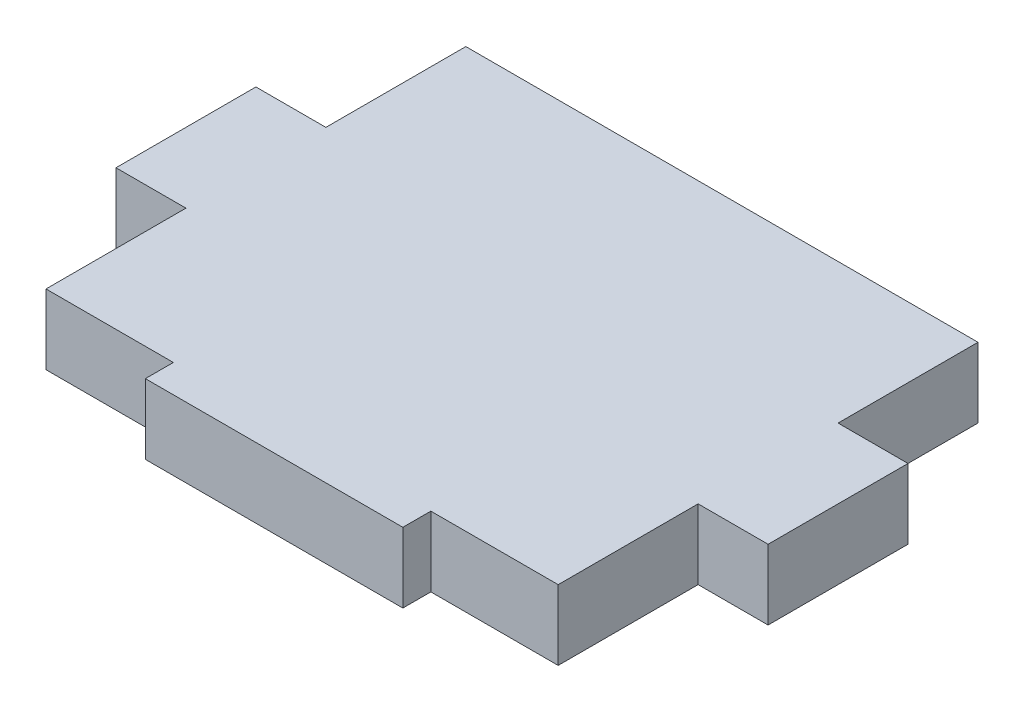
from build123d import *

# Parameters (mm, degrees)
SKETCH1_W           = 46.482
SKETCH1_H           = 38.1
BOSS_EXTRUDE1_DEPTH = 3.175
SKETCH2_W           = 23.368
SKETCH2_H           = 2.54
SKETCH2_W_2         = 6.35
SKETCH2_H_2         = 12.7
BOSS_EXTRUDE2_DEPTH = 6.35


with BuildPart() as part:
    # Sketch1 → Boss-Extrude1 (new, symmetric)
    with BuildSketch(Plane(origin=(0, 0, 0), x_dir=(1, 0, 0), z_dir=(0, 1, 0))):
        Rectangle(SKETCH1_W, SKETCH1_H)
    extrude(amount=BOSS_EXTRUDE1_DEPTH, both=True)

    # Sketch2 → Boss-Extrude2 (add)
    with BuildSketch(Plane(origin=(0, 3.175, 0), x_dir=(1, 0, 0), z_dir=(0, 1, 0))):
        with Locations((0, -20.32)):
            Rectangle(SKETCH2_W, SKETCH2_H)
        with Locations((-26.416, 0)):
            Rectangle(SKETCH2_W_2, SKETCH2_H_2)
        with Locations((26.416, 0)):
            Rectangle(SKETCH2_W_2, SKETCH2_H_2)
    extrude(amount=-BOSS_EXTRUDE2_DEPTH)


solid = part.part
